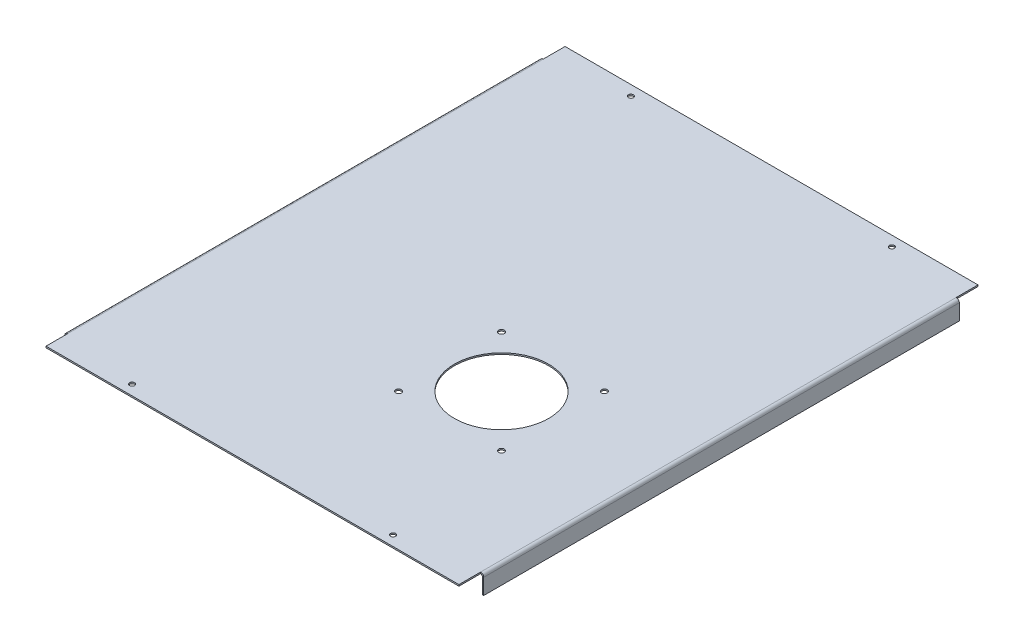
from build123d import *

# Parameters (mm, degrees)
SKETCH_1_W                         = 287
SKETCH_1_H                         = 358
SM_BASE_FLANGE_1_DEPTH             = 1
SM_EDGE_FLANGE_1_STRIP_W           = 6.2
SM_EDGE_FLANGE_1_STRIP_H           = 1
SM_EDGE_FLANGE_1_STRIP_CUT_DEPTH   = 358
SM_EDGE_FLANGE_1_STRIP_2_W         = 6.2
SM_EDGE_FLANGE_1_STRIP_2_H         = 1
SM_EDGE_FLANGE_1_STRIP_CUT_2_DEPTH = 358
SM_EDGE_FLANGE_1_DEPTH             = 358
SM_EDGE_FLANGE_1_BEND_DEPTH        = 358
SKETCH_10_W                        = 15
SKETCH_10_H                        = 15
CUT_EXTRUDE_2_DEPTH                = 2.1
SKETCH_11_W                        = 15
SKETCH_11_H                        = 14.697316693
CUT_EXTRUDE_3_DEPTH                = 2.1
SKETCH_12_W                        = 15
SKETCH_12_H                        = 14.830573141
CUT_EXTRUDE_4_DEPTH                = 2.1
SKETCH_13_W                        = 15
SKETCH_13_H                        = 16.610777732
CUT_EXTRUDE_5_DEPTH                = 2.1
SKETCH_14_R                        = 1.75
CUT_EXTRUDE_6_DEPTH                = 10
SKETCH_15_R                        = 32.5
CUT_EXTRUDE_7_DEPTH                = 10
SKETCH_16_R                        = 2
CUT_EXTRUDE_8_DEPTH                = 10


# Sheet-metal steps are written as plain solids
with BuildPart() as part:
    # Sketch 1 → Базовая кромка1 (new body)
    with BuildSketch(Plane(origin=(0, 0, 0), x_dir=(1, 0, 0), z_dir=(0, 1, 0))):
        with Locations((108.072246785, -132.29374857)):
            Rectangle(SKETCH_1_W, SKETCH_1_H)
    extrude(amount=-SM_BASE_FLANGE_1_DEPTH)

    # Ребро-кромка1 strip (across the edge) → Ребро-кромка1 strip cut (cut)
    with BuildSketch(Plane(origin=(251.572246785, -1, -46.70625143), x_dir=(-1, 0, 0), z_dir=(0, 0, 1))):
        with Locations((-2, -0.5)):
            Rectangle(SM_EDGE_FLANGE_1_STRIP_W, SM_EDGE_FLANGE_1_STRIP_H)
    extrude(amount=SM_EDGE_FLANGE_1_STRIP_CUT_DEPTH, mode=Mode.SUBTRACT)

    # Ребро-кромка1 strip 2 (across the edge) → Ребро-кромка1 strip cut 2 (cut)
    with BuildSketch(Plane(origin=(-35.427753215, -1, 311.29374857), x_dir=(1, 0, 0), z_dir=(0, 0, -1))):
        with Locations((-2, -0.5)):
            Rectangle(SM_EDGE_FLANGE_1_STRIP_2_W, SM_EDGE_FLANGE_1_STRIP_2_H)
    extrude(amount=SM_EDGE_FLANGE_1_STRIP_CUT_2_DEPTH, mode=Mode.SUBTRACT)

    # Ребро-кромка1 section (across the edge) → Ребро-кромка1 (add)
    with BuildSketch(Plane(origin=(251.572246785, -1, -46.70625143), x_dir=(-1, 0, 0), z_dir=(0, 0, 1))):
        with BuildLine():
            Line((-1, 1.1), (-1, 12))
            Line((-1, 12), (0, 12))
            Line((0, 12), (0, 1.1))
            ThreePointArc((0, 1.1), (0.322182541, 0.322182541), (1.1, 0))
            Line((1.1, 0), (1.1, -1))
            ThreePointArc((1.1, -1), (-0.38492424, -0.38492424), (-1, 1.1))
        make_face()
    extrude(amount=SM_EDGE_FLANGE_1_DEPTH)

    # Ребро-кромка1 section 2 (across the edge) → Ребро-кромка1 bend (add)
    with BuildSketch(Plane(origin=(-35.427753215, -1, 311.29374857), x_dir=(1, 0, 0), z_dir=(0, 0, -1))):
        with BuildLine():
            Line((-1, 1.1), (-1, 12))
            Line((-1, 12), (0, 12))
            Line((0, 12), (0, 1.1))
            ThreePointArc((0, 1.1), (0.322182541, 0.322182541), (1.1, 0))
            Line((1.1, 0), (1.1, -1))
            ThreePointArc((1.1, -1), (-0.38492424, -0.38492424), (-1, 1.1))
        make_face()
    extrude(amount=SM_EDGE_FLANGE_1_BEND_DEPTH)

    # Эскиз10 → Вырез-Вытянуть2 (cut)
    with BuildSketch(Plane(origin=(252.572246785, 0, 0), x_dir=(0, 0, -1), z_dir=(1, 0, 0))):
        with Locations((39.20625143, -5.5)):
            Rectangle(SKETCH_10_W, SKETCH_10_H)
    extrude(amount=-CUT_EXTRUDE_2_DEPTH, mode=Mode.SUBTRACT)

    # Эскиз11 → Вырез-Вытянуть3 (cut)
    with BuildSketch(Plane(origin=(252.572246785, 0, 0), x_dir=(0, 0, -1), z_dir=(1, 0, 0))):
        with Locations((-303.79374857, -5.651341654)):
            Rectangle(SKETCH_11_W, SKETCH_11_H)
    extrude(amount=-CUT_EXTRUDE_3_DEPTH, mode=Mode.SUBTRACT)

    # Эскиз12 → Вырез-Вытянуть4 (cut)
    with BuildSketch(Plane.ZY.offset(36.427753215)):
        with Locations((303.79374857, -5.584713429)):
            Rectangle(SKETCH_12_W, SKETCH_12_H)
    extrude(amount=-CUT_EXTRUDE_4_DEPTH, mode=Mode.SUBTRACT)

    # Эскиз13 → Вырез-Вытянуть5 (cut)
    with BuildSketch(Plane.ZY.offset(36.427753215)):
        with Locations((-39.20625143, -4.694611134)):
            Rectangle(SKETCH_13_W, SKETCH_13_H)
    extrude(amount=-CUT_EXTRUDE_5_DEPTH, mode=Mode.SUBTRACT)

    # Эскиз14 → Вырез-Вытянуть6 (cut)
    with BuildSketch(Plane(origin=(0, 0, 0), x_dir=(1, 0, 0), z_dir=(0, 1, 0))):
        with Locations(Location((18.072246785, -304.29374857, 0), (0, 0, 270))):
            Circle(SKETCH_14_R)
        with Locations(Location((198.072246785, -304.29374857, 0), (0, 0, 270))):
            Circle(SKETCH_14_R)
        with Locations(Location((18.072246785, 39.70625143, 0), (0, 0, 270))):
            Circle(SKETCH_14_R)
        with Locations(Location((198.072246785, 39.70625143, 0), (0, 0, 270))):
            Circle(SKETCH_14_R)
    extrude(amount=-CUT_EXTRUDE_6_DEPTH, mode=Mode.SUBTRACT)

    # Эскиз15 → Вырез-Вытянуть7 (cut)
    with BuildSketch(Plane(origin=(0, 0, 0), x_dir=(1, 0, 0), z_dir=(0, 1, 0))):
        with Locations(Location((149.710381915, -181.167811182, 0), (0, 0, 270))):
            Circle(SKETCH_15_R)
    extrude(amount=-CUT_EXTRUDE_7_DEPTH, mode=Mode.SUBTRACT)

    # Эскиз16 → Вырез-Вытянуть8 (cut)
    with BuildSketch(Plane.XZ.offset(1)):
        with Locations(Location((114.21015579, 216.667585055, 0), (0, 0, 270))):
            Circle(SKETCH_16_R)
        with Locations(Location((185.210155788, 216.668037307, 0), (0, 0, 270))):
            Circle(SKETCH_16_R)
        with Locations(Location((114.210608042, 145.667585057, 0), (0, 0, 270))):
            Circle(SKETCH_16_R)
        with Locations(Location((185.21060804, 145.668037309, 0), (0, 0, 270))):
            Circle(SKETCH_16_R)
    extrude(amount=-CUT_EXTRUDE_8_DEPTH, mode=Mode.SUBTRACT)


solid = part.part
